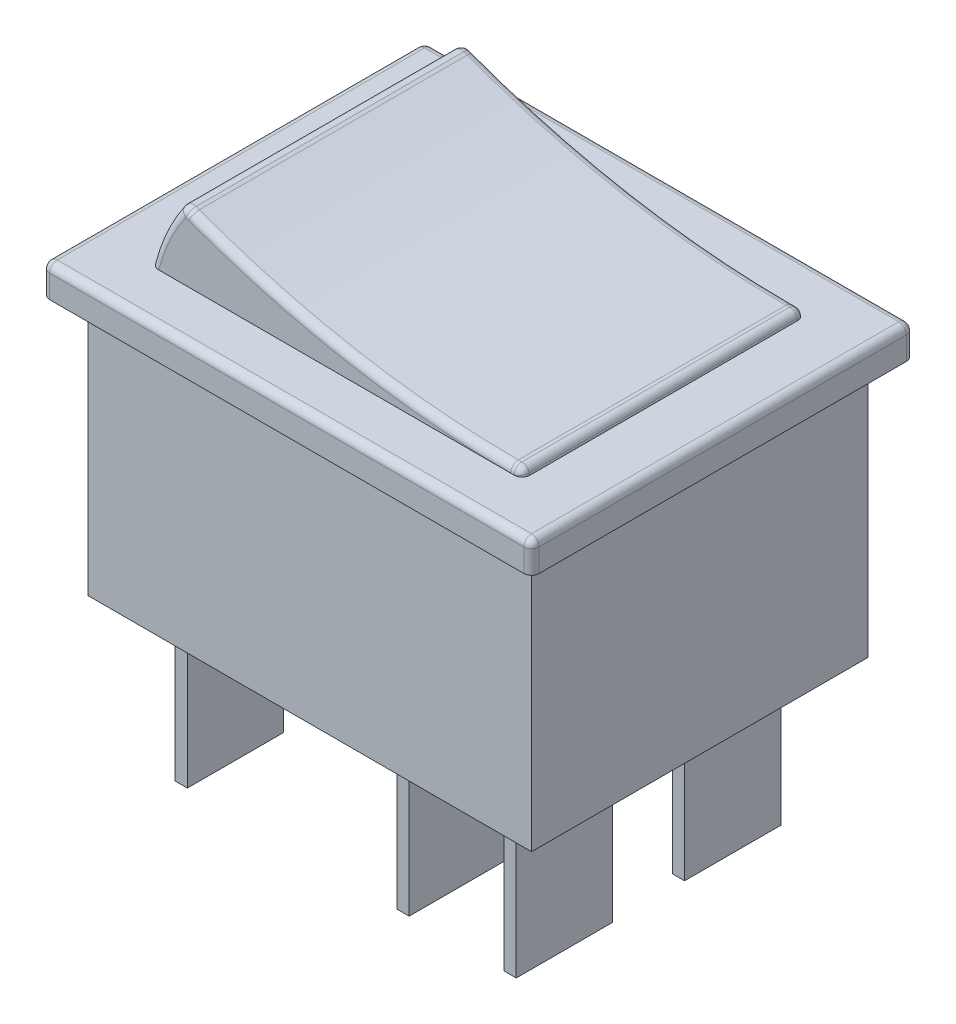
from build123d import *

# Parameters (mm, degrees)
ESQUISSE1_W          = 32
ESQUISSE1_H          = 25
BOSS_EXTRU_1_DEPTH   = 2
CONG_1_R             = 0.5
ESQUISSE2_W          = 29
ESQUISSE2_H          = 22
BOSS_EXTRU_2_DEPTH   = 17
ESQUISSE3_W          = 0.8
ESQUISSE3_H          = 6.3
BOSS_EXTRU_3_DEPTH   = 10
BOSS_EXTRU_3_2_DEPTH = 10
BOSS_EXTRU_3_3_DEPTH = 10
BOSS_EXTRU_3_4_DEPTH = 10
BOSS_EXTRU_3_5_DEPTH = 10
BOSS_EXTRU_3_6_DEPTH = 10
BOSS_EXTRU_4_DEPTH   = 9.25
CONG_2_R             = 0.5


with BuildPart() as part:
    # Esquisse1 → Boss.-Extru.1 (new body)
    with BuildSketch(Plane(origin=(0, 0, 0), x_dir=(1, 0, 0), z_dir=(0, 1, 0))):
        Rectangle(ESQUISSE1_W, ESQUISSE1_H)
    extrude(amount=BOSS_EXTRU_1_DEPTH)

    # Congé1
    cong_1_edges = [part.edges().sort_by_distance(p)[0] for p in [
        (-16, 2, 0),
        (0, 2, 12.5),
        (16, 2, 0),
        (0, 2, -12.5),
        (16, 1, 12.5),
        (-16, 1, 12.5),
        (-16, 1, -12.5),
        (16, 1, -12.5),
    ]]
    fillet(cong_1_edges, radius=CONG_1_R)

    # Esquisse2 → Boss.-Extru.2 (add)
    with BuildSketch(Plane.XZ):
        Rectangle(ESQUISSE2_W, ESQUISSE2_H)
    extrude(amount=BOSS_EXTRU_2_DEPTH)


with BuildPart() as body_2:
    # Esquisse3 → Boss.-Extru.3 (new body)
    with BuildSketch(Plane.XZ.offset(17)):
        with Locations((-10.75, 5.5)):
            Rectangle(ESQUISSE3_W, ESQUISSE3_H)
    extrude(amount=BOSS_EXTRU_3_DEPTH)


with BuildPart() as body_3:
    # Esquisse3 → Boss.-Extru.3 2 (new body)
    with BuildSketch(Plane.XZ.offset(17)):
        with Locations((10.75, 5.5)):
            Rectangle(ESQUISSE3_W, ESQUISSE3_H)
    extrude(amount=BOSS_EXTRU_3_2_DEPTH)


with BuildPart() as body_4:
    # Esquisse3 → Boss.-Extru.3 3 (new body)
    with BuildSketch(Plane.XZ.offset(17)):
        with Locations((3.75, 5.5)):
            Rectangle(ESQUISSE3_W, ESQUISSE3_H)
    extrude(amount=BOSS_EXTRU_3_3_DEPTH)


with BuildPart() as body_5:
    # Esquisse3 → Boss.-Extru.3 4 (new body)
    with BuildSketch(Plane.XZ.offset(17)):
        with Locations((3.75, -5.5)):
            Rectangle(ESQUISSE3_W, ESQUISSE3_H)
    extrude(amount=BOSS_EXTRU_3_4_DEPTH)


with BuildPart() as body_6:
    # Esquisse3 → Boss.-Extru.3 5 (new body)
    with BuildSketch(Plane.XZ.offset(17)):
        with Locations((10.75, -5.5)):
            Rectangle(ESQUISSE3_W, ESQUISSE3_H)
    extrude(amount=BOSS_EXTRU_3_5_DEPTH)


with BuildPart() as body_7:
    # Esquisse3 → Boss.-Extru.3 6 (new body)
    with BuildSketch(Plane.XZ.offset(17)):
        with Locations((-10.75, -5.5)):
            Rectangle(ESQUISSE3_W, ESQUISSE3_H)
    extrude(amount=BOSS_EXTRU_3_6_DEPTH)


with BuildPart() as body_8:
    # Esquisse4 → Boss.-Extru.4 (new, symmetric)
    with BuildSketch(Plane.XY):
        with BuildLine():
            Line((-12.1346611, 2), (12.1346611, 2))
            ThreePointArc((12.1346611, 2), (12.119028191, 2.062540727), (12.103072957, 2.125))
            ThreePointArc((12.103072957, 2.125), (11.925136256, 2.395284708), (11.618950039, 2.5))
            Line((11.618950039, 2.5), (11.38589526, 2.5))
            ThreePointArc((11.38589526, 2.5), (0.796450029, 3.441862121), (-9.460535289, 6.237878343))
            Line((-9.460535289, 6.237878343), (-9.679071228, 6.318851014))
            ThreePointArc((-9.679071228, 6.318851014), (-10.002565, 6.327040767), (-10.263324461, 6.135416667))
            ThreePointArc((-10.263324461, 6.135416667), (-11.388277176, 4.153362296), (-12.1346611, 2))
        make_face()
    extrude(amount=BOSS_EXTRU_4_DEPTH, both=True)

    # Congé2
    cong_2_edges = [body_8.edges().sort_by_distance(p)[0] for p in [
        (12.119028191, 2.062540727, 9.25),
        (-11.388277176, 4.153362296, -9.25),
        (11.925136256, 2.395284708, 9.25),
        (11.502422649, 2.5, 9.25),
        (0.796450029, 3.441862121, 9.25),
        (-9.569803259, 6.278364678, 9.25),
        (-10.002565, 6.327040767, 9.25),
        (-11.388277176, 4.153362296, 9.25),
        (-10.002565, 6.327040767, -9.25),
        (-9.569803259, 6.278364678, -9.25),
        (0.796450029, 3.441862121, -9.25),
        (11.502422649, 2.5, -9.25),
        (11.925136256, 2.395284708, -9.25),
        (12.119028191, 2.062540727, -9.25),
    ]]
    fillet(cong_2_edges, radius=CONG_2_R - 0.0001)  # a hair under: the kernel refuses the full size


solid = Compound([part.part, body_2.part, body_3.part, body_4.part, body_5.part, body_6.part, body_7.part, body_8.part])
